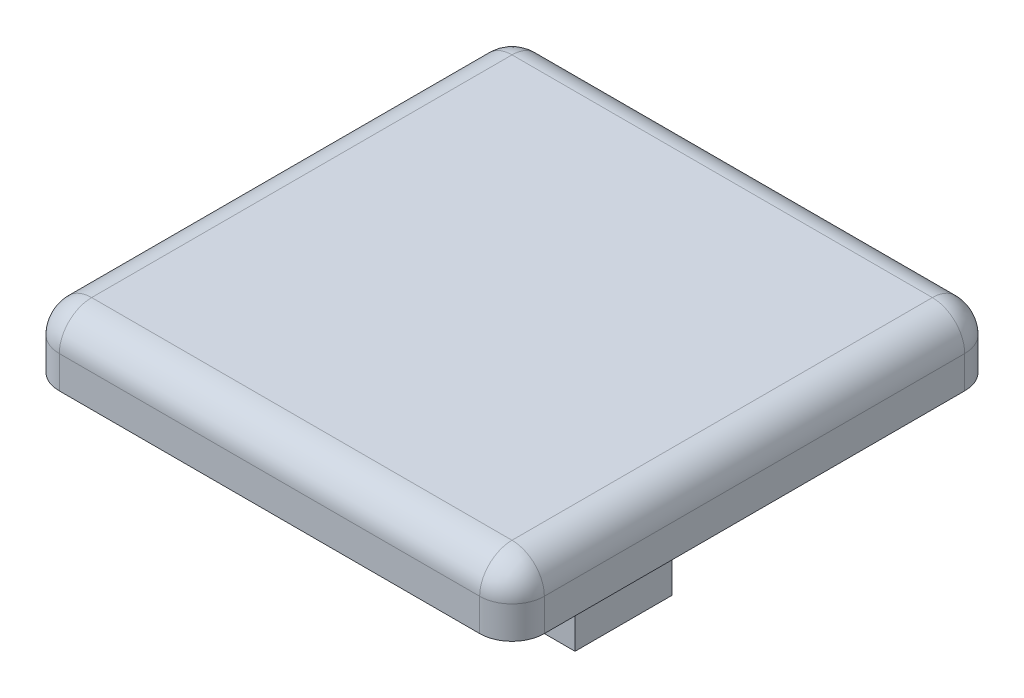
from build123d import *

# Parameters (mm, degrees)
SKETCH_1_W      = 15
SKETCH_1_H      = 15
EXTRUDE_1_DEPTH = 2
FILLET_1_R      = 1
SKETCH_2_W      = 1.2
SKETCH_2_H      = 3
EXTRUDE_2_DEPTH = 5


with BuildPart() as part:
    # 草图1 → 凸台-拉伸1 (new body)
    with BuildSketch(Plane(origin=(0, 0, 0), x_dir=(1, 0, 0), z_dir=(0, 1, 0))):
        with Locations((30.528568239, 7.5)):
            Rectangle(SKETCH_1_W, SKETCH_1_H)
    extrude(amount=EXTRUDE_1_DEPTH)

    # 圆角1
    fillet_1_edges = [part.edges().sort_by_distance(p)[0] for p in [
        (30.528568239, 2, 0),
        (38.028568239, 2, -7.5),
        (23.028568239, 2, -7.5),
        (30.528568239, 2, -15),
        (38.028568239, 1, -15),
        (23.028568239, 1, -15),
        (38.028568239, 1, 0),
        (23.028568239, 1, 0),
    ]]
    fillet(fillet_1_edges, radius=FILLET_1_R)

    # 草图2 → 凸台-拉伸2 (add)
    with BuildSketch(Plane.XZ):
        with Locations((33.378568239, -7.5)):
            Rectangle(SKETCH_2_W, SKETCH_2_H)
        with Locations((27.678568239, -7.5)):
            Rectangle(SKETCH_2_W, SKETCH_2_H)
    extrude(amount=EXTRUDE_2_DEPTH)


solid = part.part
